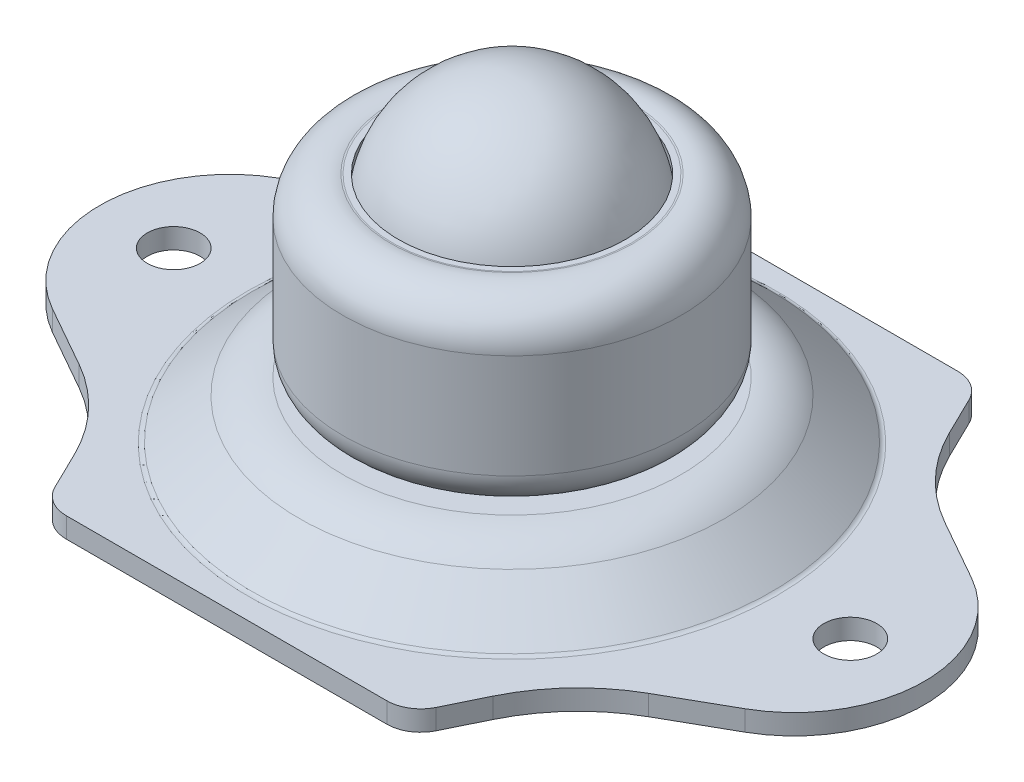
from build123d import *

# Parameters (mm, degrees)
SKETCH9_OUTSIDE_W   = 82.146
SKETCH9_OUTSIDE_H   = 82.146
CUT_EXTRUDE3_DEPTH  = 51.61362295
SKETCH8_R           = 1.984375
CUT_EXTRUDE1_DEPTH  = 45.58308274
FILLET1_R           = 0.508
BOSS_EXTRUDE2_START = -0.762
SKETCH7_R           = 8.521110051
BOSS_EXTRUDE2_DEPTH = 2.286


# Read off the part's stored shape, not the designer's step: Move Face1
with BuildPart() as part:
    # Sketch4 → Revolve3 (revolve)
    with BuildSketch(Plane.XY, mode=Mode.PRIVATE) as revolve3_sk:
        with BuildLine():
            Line((19.515272333, 1.644486874), (15.984776665, 4.637131257))
            ThreePointArc((15.984776665, 4.637131257), (14.449390353, 5.531280176), (12.7, 5.842))
            Line((12.7, 5.842), (7.62, 5.842))
            Line((7.62, 5.842), (7.62, 4.318))
            Line((7.62, 4.318), (12.7, 4.318))
            ThreePointArc((12.7, 4.318), (13.924573247, 4.100496123), (14.999343666, 3.47459188))
            Line((14.999343666, 3.47459188), (18.529839334, 0.481947497))
            ThreePointArc((18.529839334, 0.481947497), (19.143993859, 0.12428793), (19.84375, 0))
            Line((19.84375, 0), (30.95625, 0))
            Line((30.95625, 0), (30.95625, 1.524))
            Line((30.95625, 1.524), (19.84375, 1.524))
            ThreePointArc((19.84375, 1.524), (19.668810965, 1.555071982), (19.515272333, 1.644486874))
        make_face()
    revolve(revolve3_sk.sketch.rotate(Axis((0, 19.05, 0), (0, -1, 0)), 180), axis=Axis((0, 19.05, 0), (0, -1, 0)))

    # Sketch9 outside → Cut-Extrude3 (cut, through all)
    with BuildSketch(Plane(origin=(0, 0, 0), x_dir=(1, 0, 0), z_dir=(0, 1, 0))):
        Rectangle(SKETCH9_OUTSIDE_W, SKETCH9_OUTSIDE_H)
        with BuildLine():
            Line((-12.032776552, 21.43125), (12.032776552, 21.43125))
            ThreePointArc((12.032776552, 21.43125), (13.377971754, 21.045791684), (14.314886108, 20.006407376))
            Line((14.314886108, 20.006407376), (15.720512319, 17.129868982))
            ThreePointArc((15.720512319, 17.129868982), (18.094123839, 13.696033599), (21.378014937, 11.118958448))
            Line((21.378014937, 11.118958448), (25.998285744, 8.503638382))
            ThreePointArc((25.998285744, 8.503638382), (30.95625, 0), (25.998285744, -8.503638382))
            Line((25.998285744, -8.503638382), (21.378014937, -11.118958448))
            ThreePointArc((21.378014937, -11.118958448), (18.094123839, -13.696033599), (15.720512319, -17.129868982))
            Line((15.720512319, -17.129868982), (14.314886108, -20.006407376))
            ThreePointArc((14.314886108, -20.006407376), (13.377971754, -21.045791684), (12.032776552, -21.43125))
            Line((12.032776552, -21.43125), (-12.032776552, -21.43125))
            ThreePointArc((-12.032776552, -21.43125), (-13.377971754, -21.045791684), (-14.314886108, -20.006407376))
            Line((-14.314886108, -20.006407376), (-15.720512319, -17.129868982))
            ThreePointArc((-15.720512319, -17.129868982), (-18.094123839, -13.696033599), (-21.378014937, -11.118958448))
            Line((-21.378014937, -11.118958448), (-25.998285744, -8.503638382))
            ThreePointArc((-25.998285744, -8.503638382), (-30.95625, 0), (-25.998285744, 8.503638382))
            Line((-25.998285744, 8.503638382), (-21.378014937, 11.118958448))
            ThreePointArc((-21.378014937, 11.118958448), (-18.094123839, 13.696033599), (-15.720512319, 17.129868982))
            Line((-15.720512319, 17.129868982), (-14.314886108, 20.006407376))
            ThreePointArc((-14.314886108, 20.006407376), (-13.377971754, 21.045791684), (-12.032776552, 21.43125))
        make_face(mode=Mode.SUBTRACT)
    extrude(amount=CUT_EXTRUDE3_DEPTH, mode=Mode.SUBTRACT)

    # Sketch8 → Cut-Extrude1 (cut, through all)
    with BuildSketch(Plane(origin=(0, 1.524, 0), x_dir=(1, 0, 0), z_dir=(0, 1, 0))):
        with Locations(Location((-25.4, 0, 0), (0, 0, 270))):
            Circle(SKETCH8_R)
        with Locations(Location((25.4, 0, 0), (0, 0, 270))):
            Circle(SKETCH8_R)
    extrude(amount=-CUT_EXTRUDE1_DEPTH, mode=Mode.SUBTRACT)


with BuildPart() as body_2:
    # Sketch1 → Revolve1 (revolve)
    with BuildSketch(Plane.XY, mode=Mode.PRIVATE) as revolve1_sk:
        with BuildLine():
            Line((12.7, 16.1925), (12.7, 8.382))
            ThreePointArc((12.7, 8.382), (11.956051224, 6.585948776), (10.16, 5.842))
            Line((10.16, 5.842), (7.62, 5.842))
            Line((7.62, 5.842), (6.743110051, 1.27))
            Line((6.743110051, 1.27), (0, 1.27))
            Line((0, 1.27), (0, 19.05))
            Line((0, 19.05), (9.035260413, 19.05))
            ThreePointArc((9.035260413, 19.05), (11.565334331, 18.516054523), (12.7, 16.1925))
        make_face()
    revolve(revolve1_sk.sketch.rotate(Axis((0, 19.05, 0), (0, -1, 0)), 180), axis=Axis((0, 19.05, 0), (0, -1, 0)))

    # Sketch3<2> → Cut-Revolve1 (revolve, cut)
    with BuildSketch(Plane.XY):
        with BuildLine():
            Line((0, 25.4), (0, 7.9375))
            ThreePointArc((0, 7.9375), (8.73125, 16.66875), (0, 25.4))
        make_face()
    revolve(axis=Axis((0, 25.4, 0), (0, -1, 0)), mode=Mode.SUBTRACT)

    # Move Face1 outline → Move Face1 (revolve, cut)
    with BuildSketch(Plane.XY):
        with BuildLine():
            Line((0, 7.9375), (0, 7.8105))
            ThreePointArc((0, 7.8105), (7.055575843, 11.312684038), (8.53218855, 19.050000009))
            Line((8.53218855, 19.050000009), (8.40026041, 19.050000008))
            ThreePointArc((8.40026041, 19.050000008), (6.965127985, 11.403608149), (0, 7.9375))
        make_face()
    revolve(axis=Axis((0, 0, 0), (0, 1, 0)), mode=Mode.SUBTRACT)

    # Fillet1
    fillet1_edges = [body_2.edges().sort_by_distance(p)[0] for p in [
        (9.035260413, 19.05, 0),
    ]]
    fillet(fillet1_edges, radius=FILLET1_R)

    # Sketch7 → Boss-Extrude2 (add)
    with BuildSketch(Plane.XZ.offset(-1.27).offset(BOSS_EXTRUDE2_START)):
        with Locations(Location((0, 0, 0), (0, 0, 270))):
            Circle(SKETCH7_R)
    extrude(amount=-BOSS_EXTRUDE2_DEPTH)


with BuildPart() as body_3:
    # Sketch3 → Revolve2 (revolve)
    with BuildSketch(Plane.XY):
        with BuildLine():
            Line((0, 25.4), (0, 7.9375))
            ThreePointArc((0, 7.9375), (8.73125, 16.66875), (0, 25.4))
        make_face()
    revolve(axis=Axis((0, 25.4, 0), (0, -1, 0)))


solid = Compound([part.part, body_2.part, body_3.part])
